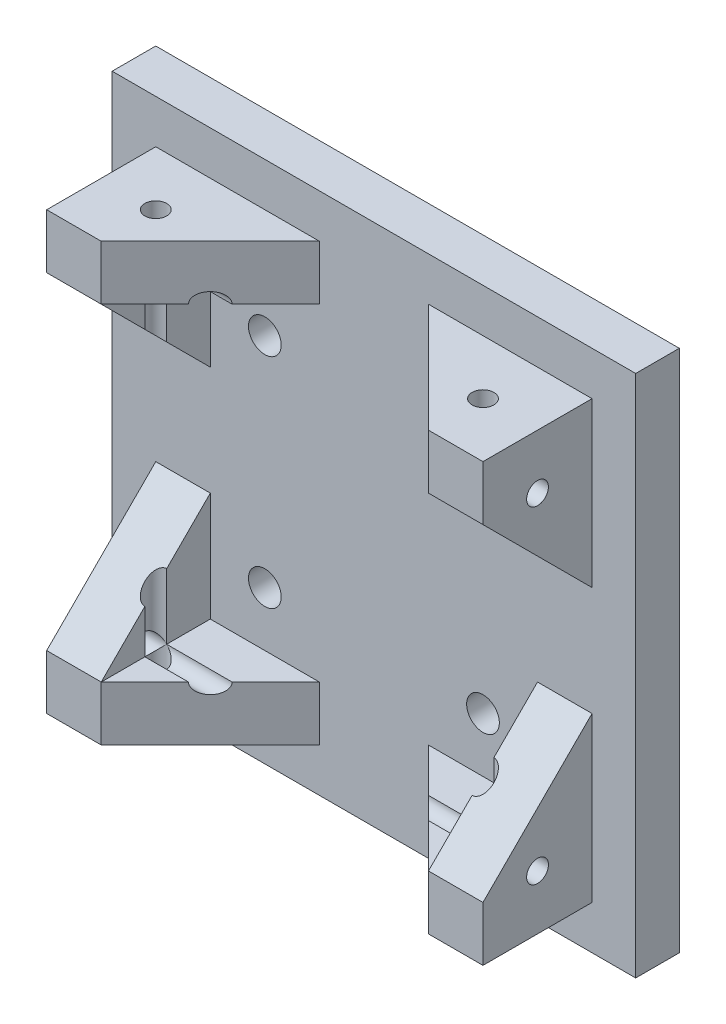
from build123d import *

# Parameters (mm, degrees)
SKIZZE1_W                       = 48
SKIZZE1_H                       = 48
AUFSATZ_LINEAR_AUSTRAGEN1_DEPTH = 4
SKIZZE2_W                       = 5
SKIZZE2_H                       = 10
SKIZZE2_W_2                     = 15
SKIZZE2_H_2                     = 5
AUFSATZ_LINEAR_AUSTRAGEN3_DEPTH = 10
FASE1_SIZE                      = 10
SCHNITT_LINEAR_AUSTRAGEN1_REACH = 68.603
SKIZZE3_R                       = 1
SCHNITT_LINEAR_AUSTRAGEN2_REACH = 68.603
SKIZZE4_R                       = 1
SCHNITT_LINEAR_AUSTRAGEN3_REACH = 70.615
SKIZZE5_R                       = 1.5


with BuildPart() as part:
    # Skizze1 → Aufsatz-Linear austragen1 (new body)
    with BuildSketch(Plane.XY):
        with Locations((24, 24)):
            Rectangle(SKIZZE1_W, SKIZZE1_H)
    extrude(amount=AUFSATZ_LINEAR_AUSTRAGEN1_DEPTH)

    # Skizze2 → Aufsatz-Linear austragen3 (add)
    with BuildSketch(Plane.XY.offset(4)):
        with Locations((6.5, 34)):
            Rectangle(SKIZZE2_W, SKIZZE2_H)
        with Locations((11.5, 41.5)):
            Rectangle(SKIZZE2_W_2, SKIZZE2_H_2)
        with Locations((36.5, 41.5)):
            Rectangle(SKIZZE2_W_2, SKIZZE2_H_2)
        with Locations((41.5, 34)):
            Rectangle(SKIZZE2_W, SKIZZE2_H)
        with Locations((41.5, 14)):
            Rectangle(SKIZZE2_W, SKIZZE2_H)
        with Locations((36.5, 6.5)):
            Rectangle(SKIZZE2_W_2, SKIZZE2_H_2)
        with Locations((11.5, 6.5)):
            Rectangle(SKIZZE2_W_2, SKIZZE2_H_2)
        with Locations((6.5, 14)):
            Rectangle(SKIZZE2_W, SKIZZE2_H)
    extrude(amount=AUFSATZ_LINEAR_AUSTRAGEN3_DEPTH)

    # Fase1
    fase1_edges = [part.edges().sort_by_distance(p)[0] for p in [
        (19, 41.5, 14),
        (29, 41.5, 14),
        (41.5, 29, 14),
        (41.5, 19, 14),
        (29, 6.5, 14),
        (6.5, 19, 14),
        (6.5, 29, 14),
        (19, 6.5, 14),
    ]]
    chamfer(fase1_edges, length=FASE1_SIZE - 0.0001)  # a hair under: the kernel refuses the full size

    # Schnitt-Linear austragen1: up to this face of the body (flat: up to its plane)
    schnitt_linear_austragen1_end = Plane(part.part.faces().sort_by_distance((9.4167125, 44, 8.166675))[0])
    # Skizze3 → Schnitt-Linear austragen1 (cut, up to the picked face)
    with BuildSketch(Plane.XZ.offset(-4), mode=Mode.PRIVATE) as schnitt_linear_austragen1_sk1:
        with Locations(Location((9, 9, 0), (0, 0, 90))):
            Circle(SKIZZE3_R)
    schnitt_linear_austragen1_tool1 = split(extrude(schnitt_linear_austragen1_sk1.sketch, amount=-SCHNITT_LINEAR_AUSTRAGEN1_REACH, mode=Mode.PRIVATE), bisect_by=schnitt_linear_austragen1_end, keep=Keep.BOTH, mode=Mode.PRIVATE)
    # Skizze3 → Schnitt-Linear austragen1 (cut, up to the picked face)
    with BuildSketch(Plane.XZ.offset(-4), mode=Mode.PRIVATE) as schnitt_linear_austragen1_sk2:
        with Locations((39, 9)):
            Circle(SKIZZE3_R)
    schnitt_linear_austragen1_tool2 = split(extrude(schnitt_linear_austragen1_sk2.sketch, amount=-SCHNITT_LINEAR_AUSTRAGEN1_REACH, mode=Mode.PRIVATE), bisect_by=schnitt_linear_austragen1_end, keep=Keep.BOTH, mode=Mode.PRIVATE)
    add(schnitt_linear_austragen1_tool1.solids().sort_by(Axis((9, 4, 9), (0, 1, 0)))[0], mode=Mode.SUBTRACT)
    add(schnitt_linear_austragen1_tool2.solids().sort_by(Axis((39, 4, 9), (0, 1, 0)))[0], mode=Mode.SUBTRACT)

    # Schnitt-Linear austragen2: up to this face of the body (flat: up to its plane)
    schnitt_linear_austragen2_end = Plane(part.part.faces().sort_by_distance((44, 9.4167125, 8.166675))[0])
    # Skizze4 → Schnitt-Linear austragen2 (cut, up to the picked face)
    with BuildSketch(Plane.ZY.offset(-4), mode=Mode.PRIVATE) as schnitt_linear_austragen2_sk1:
        with Locations(Location((9, 39, 0), (0, 0, 180))):
            Circle(SKIZZE4_R)
    schnitt_linear_austragen2_tool1 = split(extrude(schnitt_linear_austragen2_sk1.sketch, amount=-SCHNITT_LINEAR_AUSTRAGEN2_REACH, mode=Mode.PRIVATE), bisect_by=schnitt_linear_austragen2_end, keep=Keep.BOTH, mode=Mode.PRIVATE)
    # Skizze4 → Schnitt-Linear austragen2 (cut, up to the picked face)
    with BuildSketch(Plane.ZY.offset(-4), mode=Mode.PRIVATE) as schnitt_linear_austragen2_sk2:
        with Locations(Location((9, 9, 0), (0, 0, 180))):
            Circle(SKIZZE4_R)
    schnitt_linear_austragen2_tool2 = split(extrude(schnitt_linear_austragen2_sk2.sketch, amount=-SCHNITT_LINEAR_AUSTRAGEN2_REACH, mode=Mode.PRIVATE), bisect_by=schnitt_linear_austragen2_end, keep=Keep.BOTH, mode=Mode.PRIVATE)
    add(schnitt_linear_austragen2_tool1.solids().sort_by(Axis((4, 39, 9), (1, 0, 0)))[0], mode=Mode.SUBTRACT)
    add(schnitt_linear_austragen2_tool2.solids().sort_by(Axis((4, 9, 9), (1, 0, 0)))[0], mode=Mode.SUBTRACT)

    # Skizze5 → Schnitt-Linear austragen3 (cut, up to next)
    with BuildSketch(Plane.XY.offset(4), mode=Mode.PRIVATE) as schnitt_linear_austragen3_sk1:
        with Locations((34, 14)):
            Circle(SKIZZE5_R)
    schnitt_linear_austragen3_tool1 = extrude(schnitt_linear_austragen3_sk1.sketch, amount=-SCHNITT_LINEAR_AUSTRAGEN3_REACH, mode=Mode.PRIVATE) & part.part
    # Skizze5 → Schnitt-Linear austragen3 (cut, up to next)
    with BuildSketch(Plane.XY.offset(4), mode=Mode.PRIVATE) as schnitt_linear_austragen3_sk2:
        with Locations((14, 14)):
            Circle(SKIZZE5_R)
    schnitt_linear_austragen3_tool2 = extrude(schnitt_linear_austragen3_sk2.sketch, amount=-SCHNITT_LINEAR_AUSTRAGEN3_REACH, mode=Mode.PRIVATE) & part.part
    # Skizze5 → Schnitt-Linear austragen3 (cut, up to next)
    with BuildSketch(Plane.XY.offset(4), mode=Mode.PRIVATE) as schnitt_linear_austragen3_sk3:
        with Locations((14, 34)):
            Circle(SKIZZE5_R)
    schnitt_linear_austragen3_tool3 = extrude(schnitt_linear_austragen3_sk3.sketch, amount=-SCHNITT_LINEAR_AUSTRAGEN3_REACH, mode=Mode.PRIVATE) & part.part
    # Skizze5 → Schnitt-Linear austragen3 (cut, up to next)
    with BuildSketch(Plane.XY.offset(4), mode=Mode.PRIVATE) as schnitt_linear_austragen3_sk4:
        with Locations((34, 34)):
            Circle(SKIZZE5_R)
    schnitt_linear_austragen3_tool4 = extrude(schnitt_linear_austragen3_sk4.sketch, amount=-SCHNITT_LINEAR_AUSTRAGEN3_REACH, mode=Mode.PRIVATE) & part.part
    add(schnitt_linear_austragen3_tool1.solids().sort_by_distance((34, 14, 4))[0], mode=Mode.SUBTRACT)
    add(schnitt_linear_austragen3_tool2.solids().sort_by_distance((14, 14, 4))[0], mode=Mode.SUBTRACT)
    add(schnitt_linear_austragen3_tool3.solids().sort_by_distance((14, 34, 4))[0], mode=Mode.SUBTRACT)
    add(schnitt_linear_austragen3_tool4.solids().sort_by_distance((34, 34, 4))[0], mode=Mode.SUBTRACT)


solid = part.part
